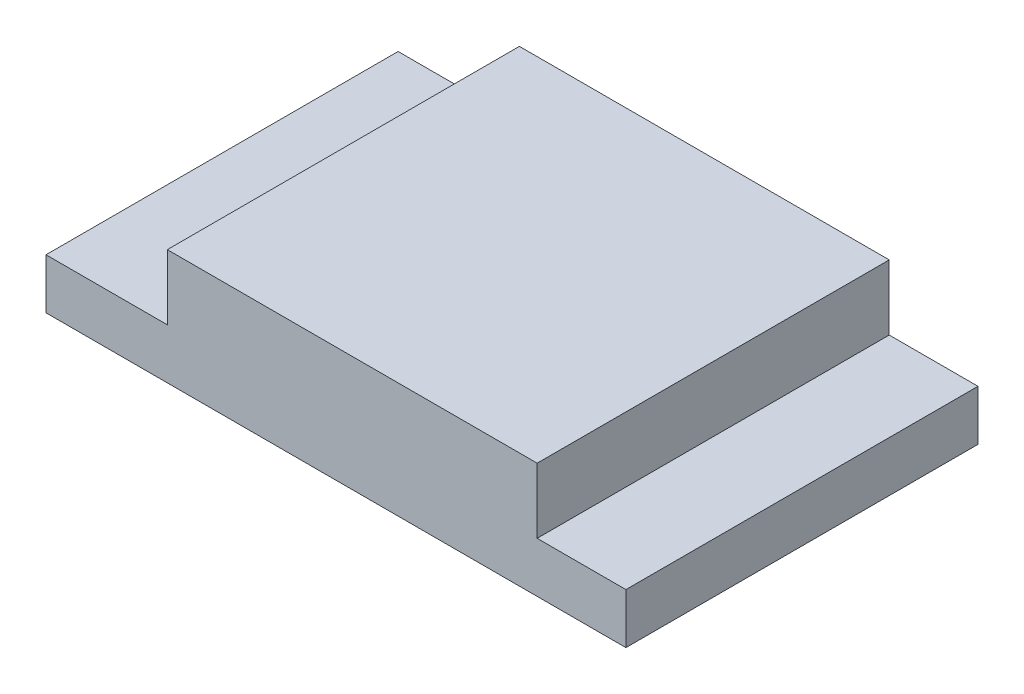
from build123d import *

# Parameters (mm, degrees)
SKETCH1_W           = 19.6
SKETCH1_H           = 11.9
BOSS_EXTRUDE1_DEPTH = 1.7
SKETCH2_W           = 12.5
SKETCH2_H           = 11.9
BOSS_EXTRUDE2_DEPTH = 2.2


with BuildPart() as part:
    # Sketch1 → Boss-Extrude1 (new body)
    with BuildSketch(Plane(origin=(0, 0, 0), x_dir=(1, 0, 0), z_dir=(0, 1, 0))):
        with Locations((9.8, 5.95)):
            Rectangle(SKETCH1_W, SKETCH1_H)
    extrude(amount=BOSS_EXTRUDE1_DEPTH)

    # Sketch2 → Boss-Extrude2 (add)
    with BuildSketch(Plane(origin=(0, 1.7, 0), x_dir=(1, 0, 0), z_dir=(0, 1, 0))):
        with Locations((10.35, 5.95)):
            Rectangle(SKETCH2_W, SKETCH2_H)
    extrude(amount=BOSS_EXTRUDE2_DEPTH)


solid = part.part
